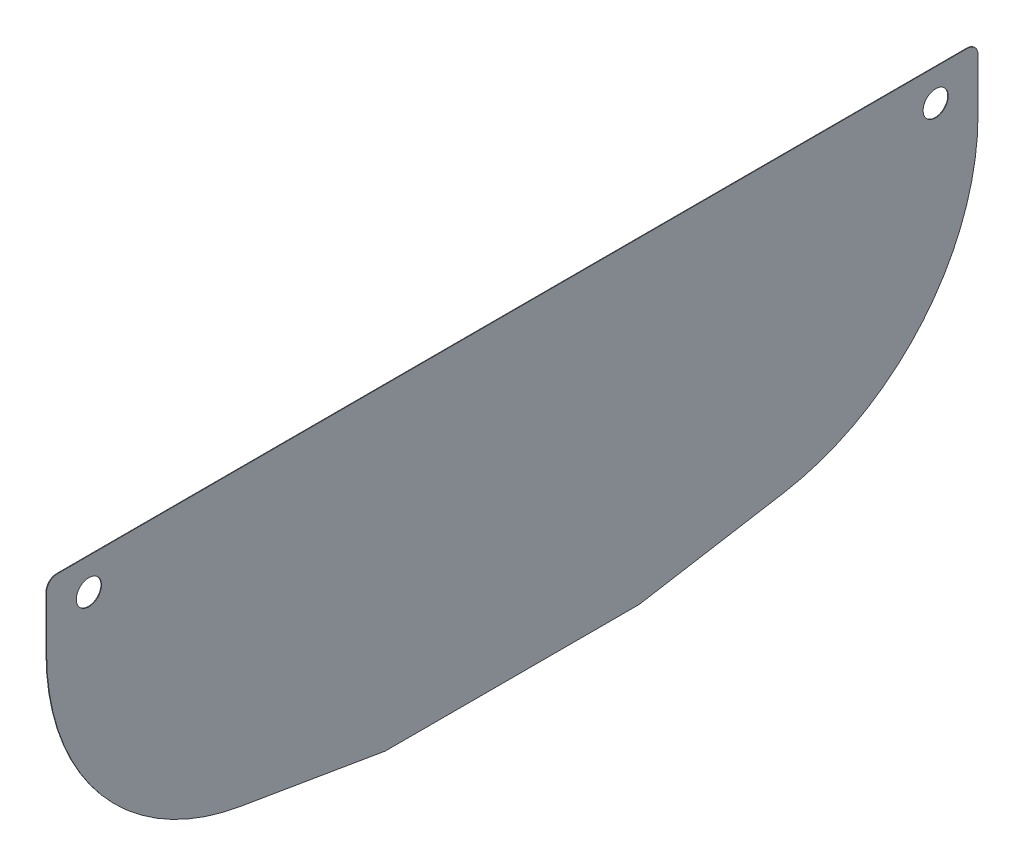
from build123d import *

# Parameters (mm, degrees)
SKETCH1_R           = 15.08125
BOSS_EXTRUDE1_DEPTH = 0.635
FILLET1_R           = 12.7


with BuildPart() as part:
    # Sketch1 → Boss-Extrude1 (new body)
    with BuildSketch(Plane(origin=(0, 0, 0), x_dir=(0, 0, -1), z_dir=(1, 0, 0))):
        with BuildLine():
            Line((-558.8, 609.6), (-558.8, 685.8))
            Line((-558.8, 685.8), (558.8, 685.8))
            Line((558.8, 685.8), (558.8, 609.6))
            ThreePointArc((558.8, 609.6), (492.779998657, 429.230002015), (325.91999876, 334.100000517))
            Line((325.91999876, 334.100000517), (152.4, 304.8))
            Line((152.4, 304.8), (-152.4, 304.8))
            Line((-152.4, 304.8), (-325.91999876, 334.100000517))
            ThreePointArc((-325.91999876, 334.100000517), (-492.779998657, 429.230002015), (-558.8, 609.6))
        make_face()
        with Locations((-508, 647.7)):
            Circle(SKETCH1_R, mode=Mode.SUBTRACT)
        with Locations((508, 647.7)):
            Circle(SKETCH1_R, mode=Mode.SUBTRACT)
    extrude(amount=BOSS_EXTRUDE1_DEPTH)

    # Fillet1
    fillet1_edges = [part.edges().sort_by_distance(p)[0] for p in [
        (0.3175, 685.8, -558.8),
        (0.3175, 685.8, 558.8),
        (0.3175, 304.8, 152.4),
        (0.3175, 304.8, -152.4),
    ]]
    fillet(fillet1_edges, radius=FILLET1_R)


solid = part.part
